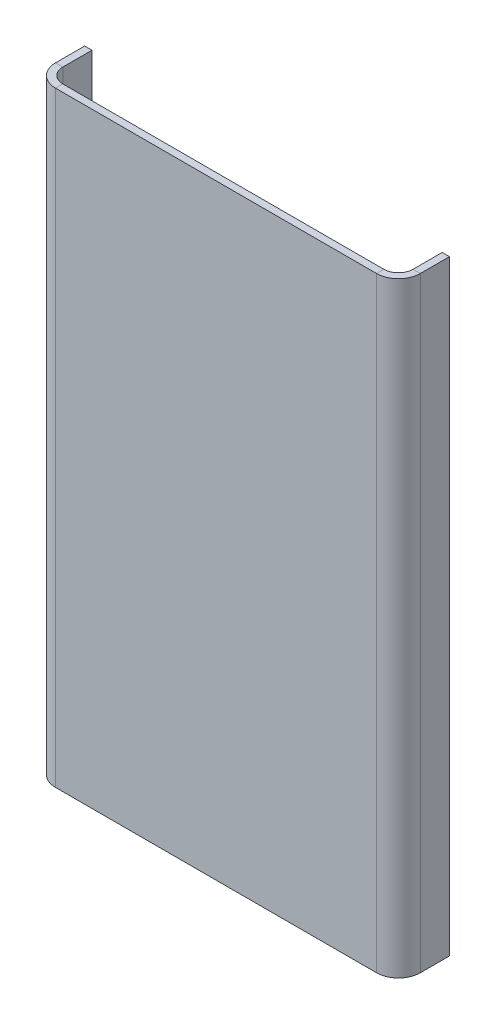
from build123d import *

# Parameters (mm, degrees)
SKETCH1_W                      = 500
SKETCH1_H                      = 830
BASE_FLANGE1_DEPTH             = 10
EDGE_FLANGE1_STRIP_W           = 80
EDGE_FLANGE1_STRIP_H           = 10
EDGE_FLANGE1_STRIP_CUT_DEPTH   = 830
EDGE_FLANGE1_STRIP_2_W         = 80
EDGE_FLANGE1_STRIP_2_H         = 10
EDGE_FLANGE1_STRIP_CUT_2_DEPTH = 830
EDGE_FLANGE1_DEPTH             = 830
EDGE_FLANGE1_BEND_DEPTH        = 830


# Sheet-metal steps are written as plain solids
with BuildPart() as part:
    # Sketch1 → Base-Flange1 (new body)
    with BuildSketch(Plane.XY):
        Rectangle(SKETCH1_W, SKETCH1_H)
    extrude(amount=-BASE_FLANGE1_DEPTH)

    # Edge-Flange1 strip (across the edge) → Edge-Flange1 strip cut (cut)
    with BuildSketch(Plane(origin=(-250, -415, -10), x_dir=(1, 0, 0), z_dir=(0, 1, 0))):
        with Locations((-10, -5)):
            Rectangle(EDGE_FLANGE1_STRIP_W, EDGE_FLANGE1_STRIP_H)
    extrude(amount=EDGE_FLANGE1_STRIP_CUT_DEPTH, mode=Mode.SUBTRACT)

    # Edge-Flange1 strip 2 (across the edge) → Edge-Flange1 strip cut 2 (cut)
    with BuildSketch(Plane(origin=(250, 415, -10), x_dir=(-1, 0, 0), z_dir=(0, -1, 0))):
        with Locations((-10, -5)):
            Rectangle(EDGE_FLANGE1_STRIP_2_W, EDGE_FLANGE1_STRIP_2_H)
    extrude(amount=EDGE_FLANGE1_STRIP_CUT_2_DEPTH, mode=Mode.SUBTRACT)

    # Edge-Flange1 section (across the edge) → Edge-Flange1 (add)
    with BuildSketch(Plane(origin=(-250, -415, -10), x_dir=(1, 0, 0), z_dir=(0, 1, 0))):
        with BuildLine():
            Line((0, 20), (0, 60))
            Line((0, 60), (10, 60))
            Line((10, 60), (10, 20))
            ThreePointArc((10, 20), (15.857864376, 5.857864376), (30, 0))
            Line((30, 0), (30, -10))
            ThreePointArc((30, -10), (8.786796564, -1.213203436), (0, 20))
        make_face()
    extrude(amount=EDGE_FLANGE1_DEPTH)

    # Edge-Flange1 section 2 (across the edge) → Edge-Flange1 bend (add)
    with BuildSketch(Plane(origin=(250, 415, -10), x_dir=(-1, 0, 0), z_dir=(0, -1, 0))):
        with BuildLine():
            Line((0, 20), (0, 60))
            Line((0, 60), (10, 60))
            Line((10, 60), (10, 20))
            ThreePointArc((10, 20), (15.857864376, 5.857864376), (30, 0))
            Line((30, 0), (30, -10))
            ThreePointArc((30, -10), (8.786796564, -1.213203436), (0, 20))
        make_face()
    extrude(amount=EDGE_FLANGE1_BEND_DEPTH)


solid = part.part
